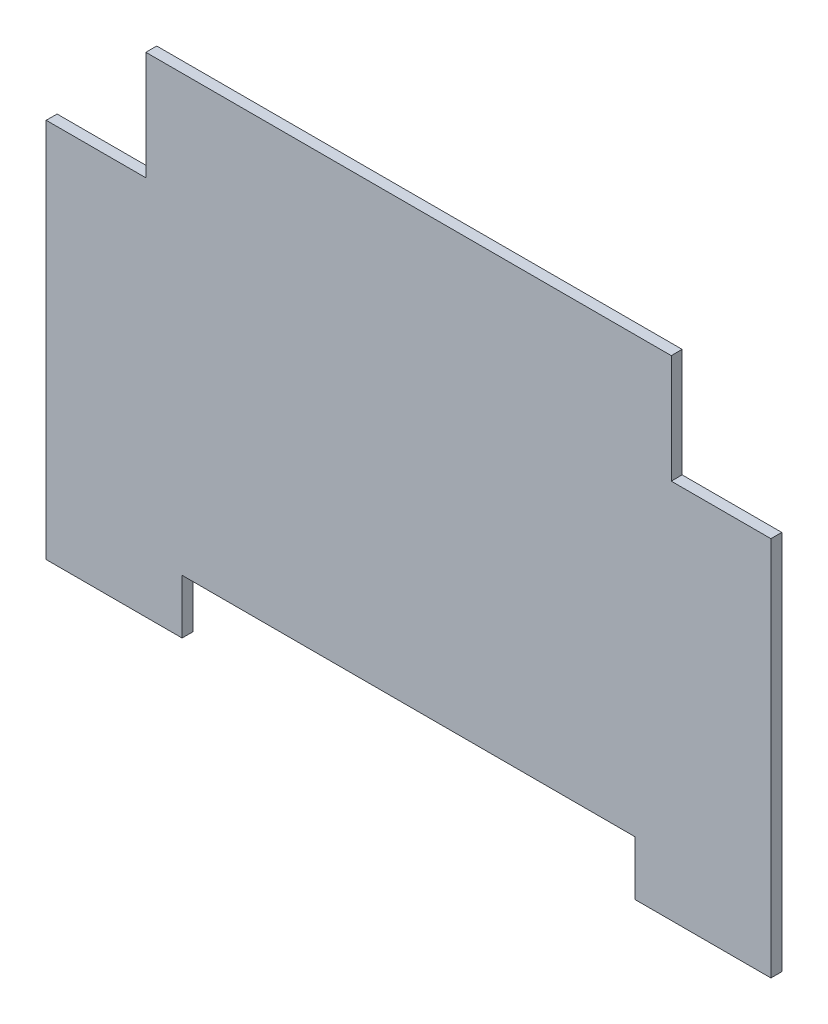
from build123d import *

# Parameters (mm, degrees)
SKETCH1_W           = 400
SKETCH1_H           = 270
BOSS_EXTRUDE1_DEPTH = 6
SKETCH2_W           = 55
SKETCH2_H           = 60
CUT_EXTRUDE1_DEPTH  = 40
SKETCH3_W           = 250
SKETCH3_H           = 30
CUT_EXTRUDE2_DEPTH  = 10


with BuildPart() as part:
    # Sketch1 → Boss-Extrude1 (new body)
    with BuildSketch(Plane.XY):
        with Locations((89.131383381, 125.666802076)):
            Rectangle(SKETCH1_W, SKETCH1_H)
    extrude(amount=BOSS_EXTRUDE1_DEPTH)

    # Sketch2 → Cut-Extrude1 (cut)
    with BuildSketch(Plane(origin=(0, 0, 0), x_dir=(-1, 0, 0), z_dir=(0, 0, -1))):
        with Locations((-261.631383381, 230.666802076)):
            Rectangle(SKETCH2_W, SKETCH2_H)
        with Locations((83.368616619, 230.666802076)):
            Rectangle(SKETCH2_W, SKETCH2_H)
    extrude(amount=-CUT_EXTRUDE1_DEPTH, mode=Mode.SUBTRACT)

    # Sketch3 → Cut-Extrude2 (cut)
    with BuildSketch(Plane(origin=(0, 0, 0), x_dir=(-1, 0, 0), z_dir=(0, 0, -1))):
        with Locations((-89.131383381, 5.666802076)):
            Rectangle(SKETCH3_W, SKETCH3_H)
    extrude(amount=-CUT_EXTRUDE2_DEPTH, mode=Mode.SUBTRACT)


solid = part.part
